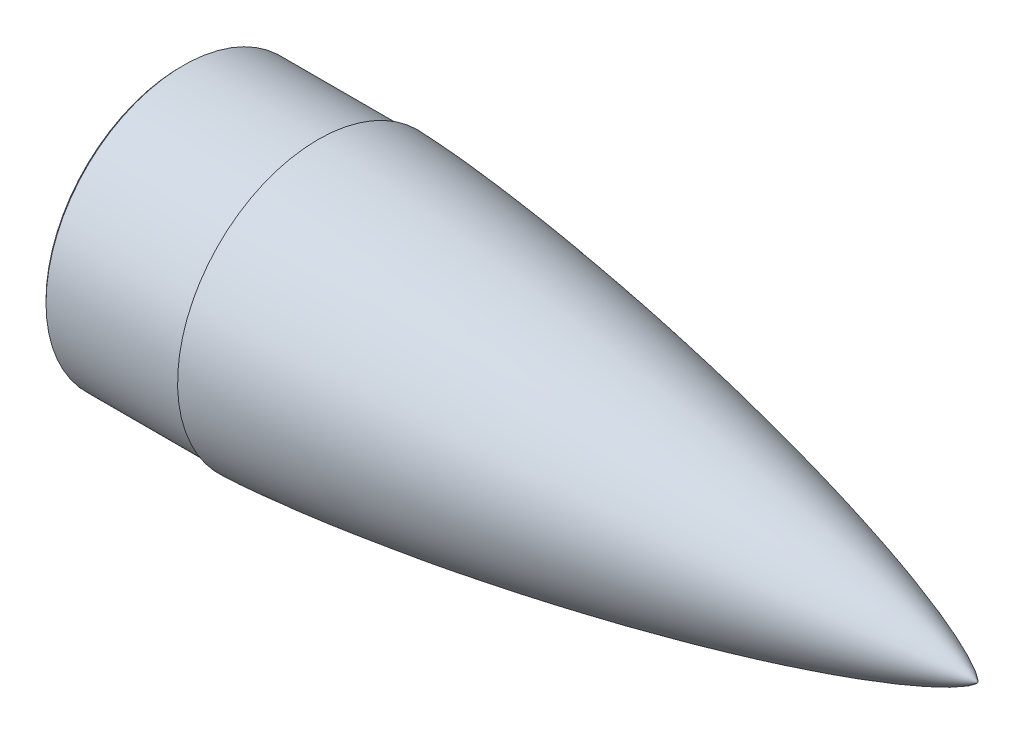
from build123d import *

# Parameters (mm, degrees)
CHAMFER1_SIZE            = 1.5
BOSS_EXTRUDE6_DEPTH      = 7.5
BOSS_EXTRUDE6_DEPTH_BACK = 7.5
SKETCH11_R               = 5
CUT_EXTRUDE1_DEPTH       = 95


with BuildPart() as part:
    # Sketch10 → Revolve1 (revolve)
    with BuildSketch(Plane.XY):
        with BuildLine():
            Line((11.112493743, 81.99983), (11.112493743, 67.49983))
            Line((11.112493743, 67.49983), (129.304508698, 67.49983))
            add(Edge.make_bspline(
                [(368.967251823, 0), (368.965299543, 0.012338489), (368.959416882, 0.036518378), (368.940636147, 0.082964007), (368.902304552, 0.158736421), (368.845538097, 0.250270687), (368.755690124, 0.376555746), (368.616653262, 0.54835284), (368.392888737, 0.793577299), (368.008659121, 1.164904965), (367.344738263, 1.729853685), (366.176060796, 2.601559154), (364.09282389, 3.960032328), (360.425978756, 6.040734396), (354.402196649, 9.01831007), (344.042994901, 13.507695011), (329.152005398, 19.128483965), (310.425167902, 25.398569259), (288.741266406, 31.933693508), (266.378532845, 38.106125474), (243.901379123, 43.846895186), (221.331994001, 49.212017941), (198.683967629, 54.234500927), (175.966897581, 58.934255644), (156.034567874, 62.771715365), (141.509051931, 65.395628269), (132.679425236, 66.924517444), (129.562757302, 67.455859883), (129.304508698, 67.49983)],
                knots=[0, 0, 0, 0, 0, 0.000134949, 0.000269899, 0.000539798, 0.000919537, 0.001299277, 0.001947431, 0.00293136, 0.004511869, 0.007081312, 0.011380263, 0.018707867, 0.031423867, 0.052705479, 0.084103008, 0.140910136, 0.203703492, 0.266497064, 0.329290816, 0.392084375, 0.454877964, 0.517671564, 0.580465191, 0.643258828, 0.674655593, 0.677492072, 0.677492072, 0.677492072, 0.677492072, 0.677492072], degree=4))
            Line((368.967251823, 0), (408.967251823, 0))
            add(Edge.make_bspline(
                [(408.967251823, 0), (408.964913524, 0.013501739), (408.958040758, 0.039916077), (408.936520441, 0.090485698), (408.892222076, 0.174057132), (408.826281575, 0.275556803), (408.721696416, 0.415833756), (408.561101809, 0.605075245), (408.30561918, 0.87242415), (407.86966713, 1.275299562), (407.120955138, 1.885142115), (405.803773451, 2.82590185), (403.46240692, 4.287152794), (399.325294488, 6.531818454), (392.481146888, 9.758904649), (380.662076725, 14.628008466), (363.637187185, 20.711720382), (342.215241093, 27.476512989), (317.428462321, 34.49762647), (291.879335737, 41.10482439), (266.21046092, 47.228993169), (240.44548836, 52.933436777), (214.598861982, 58.255439009), (188.68089566, 63.217582693), (165.946174917, 67.253280679), (146.421982586, 70.493799722), (130.127893898, 73.044947468), (117.078590637, 74.994157933), (104.015464216, 76.84854079), (92.573263959, 78.384492045), (82.757139441, 79.635603973), (74.571340184, 80.632219902), (68.019260454, 81.400804211), (61.463723364, 82.139375899), (54.90469802, 82.84637726), (48.342159918, 83.519940506), (41.776057559, 84.15778717), (36.02754108, 84.682157239), (31.097921259, 85.105234912), (26.988317923, 85.438669825), (23.699666618, 85.693218594), (20.085807822, 85.958448038), (16.719873821, 86.189018485), (13.602098287, 86.386966779), (10.732704013, 86.554575744), (8.436635008, 86.678703291), (6.139997341, 86.792157585), (4.129892063, 86.879313264), (2.40653858, 86.944618982), (1.257348635, 86.979022496), (0.68269791, 86.99491462), (0.395312527, 86.99983)],
                knots=[0, 0, 0, 0, 0, 0.000130123, 0.000260245, 0.000520491, 0.000900391, 0.00128029, 0.001925099, 0.002881508, 0.004418208, 0.006927086, 0.011110697, 0.018279138, 0.03067276, 0.051704469, 0.08310228, 0.139908797, 0.202702513, 0.265496165, 0.328289682, 0.391083359, 0.453876973, 0.516670577, 0.579464197, 0.642257765, 0.673654596, 0.705051427, 0.736448267, 0.767845106, 0.799241874, 0.814940257, 0.830638641, 0.846337073, 0.862035505, 0.877733936, 0.893432368, 0.90913072, 0.924829072, 0.932678248, 0.940527424, 0.9483766, 0.956225776, 0.967169332, 0.97264111, 0.978112888, 0.983584666, 0.989056444, 0.994528222, 0.997264111, 1, 1, 1, 1, 1], degree=4))
            Line((0.395312527, 86.99983), (0.395312527, 84.99983))
            Line((0.395312527, 84.99983), (-84.604517473, 84.99983))
            Line((-84.604517473, 84.99983), (-84.604517473, 81.99983))
            Line((-84.604517473, 81.99983), (11.112493743, 81.99983))
        make_face()
    revolve(axis=Axis((46.917858469, 0, 0), (-1, 0, 0)))

    # Chamfer1
    chamfer1_edges = [part.edges().sort_by_distance(p)[0] for p in [
        (-84.604517473, -84.99983, 0),
    ]]
    chamfer(chamfer1_edges, length=CHAMFER1_SIZE)

    # Sketch11 → Boss-Extrude6 (add, two sides: drawn at the far end of the back side and taken through both)
    # profile 1 of 4: a face of its own
    with BuildSketch(Plane(origin=(70, 0, 0), x_dir=(0, 0, -1), z_dir=(1, 0, 0)).offset(-BOSS_EXTRUDE6_DEPTH_BACK)):
        with BuildLine():
            Line((39.645757239, 13.018375058), (39.645757239, -13.018375058))
            Line((39.645757239, -13.018375058), (66.232710279, -13.018375058))
            ThreePointArc((66.232710279, -13.018375058), (67.5, 0), (66.232710279, 13.018375058))
            Line((66.232710279, 13.018375058), (39.645757239, 13.018375058))
        make_face()
        with Locations((52.145757239, 0)):
            Circle(SKETCH11_R, mode=Mode.SUBTRACT)
    # profile 2 of 4: a face of its own
    with BuildSketch(Plane(origin=(70, 0, 0), x_dir=(0, 0, -1), z_dir=(1, 0, 0)).offset(-BOSS_EXTRUDE6_DEPTH_BACK)):
        with BuildLine():
            ThreePointArc((-13.018375058, -66.232710279), (0, -67.5), (13.018375058, -66.232710279))
            Line((13.018375058, -66.232710279), (13.018375058, -39.645757239))
            Line((13.018375058, -39.645757239), (-13.018375058, -39.645757239))
            Line((-13.018375058, -39.645757239), (-13.018375058, -66.232710279))
        make_face()
        with Locations((0, -52.145757239)):
            Circle(SKETCH11_R, mode=Mode.SUBTRACT)
    # profile 3 of 4: a face of its own
    with BuildSketch(Plane(origin=(70, 0, 0), x_dir=(0, 0, -1), z_dir=(1, 0, 0)).offset(-BOSS_EXTRUDE6_DEPTH_BACK)):
        with BuildLine():
            Line((13.018375058, 39.645757239), (13.018375058, 66.232710279))
            ThreePointArc((13.018375058, 66.232710279), (0, 67.5), (-13.018375058, 66.232710279))
            Line((-13.018375058, 66.232710279), (-13.018375058, 39.645757239))
            Line((-13.018375058, 39.645757239), (13.018375058, 39.645757239))
        make_face()
        with Locations((0, 52.145757239)):
            Circle(SKETCH11_R, mode=Mode.SUBTRACT)
    # profile 4 of 4: a face of its own
    with BuildSketch(Plane(origin=(70, 0, 0), x_dir=(0, 0, -1), z_dir=(1, 0, 0)).offset(-BOSS_EXTRUDE6_DEPTH_BACK)):
        with BuildLine():
            ThreePointArc((-66.232710279, 13.018375058), (-67.5, 0), (-66.232710279, -13.018375058))
            Line((-66.232710279, -13.018375058), (-39.645757239, -13.018375058))
            Line((-39.645757239, -13.018375058), (-39.645757239, 13.018375058))
            Line((-39.645757239, 13.018375058), (-66.232710279, 13.018375058))
        make_face()
        with Locations((-52.145757239, 0)):
            Circle(SKETCH11_R, mode=Mode.SUBTRACT)
    extrude(amount=BOSS_EXTRUDE6_DEPTH + BOSS_EXTRUDE6_DEPTH_BACK)

    # Sketch16 → Cut-Extrude1 (cut)
    with BuildSketch(Plane.XY):
        Polygon((93.213036915, 0.912025948), (93.213036915, 5), (98.213036915, 5), (98.213036915, -4.087974052), (93.213036915, -4.087974052), align=None)
    extrude(amount=-CUT_EXTRUDE1_DEPTH, mode=Mode.SUBTRACT)


solid = part.part
